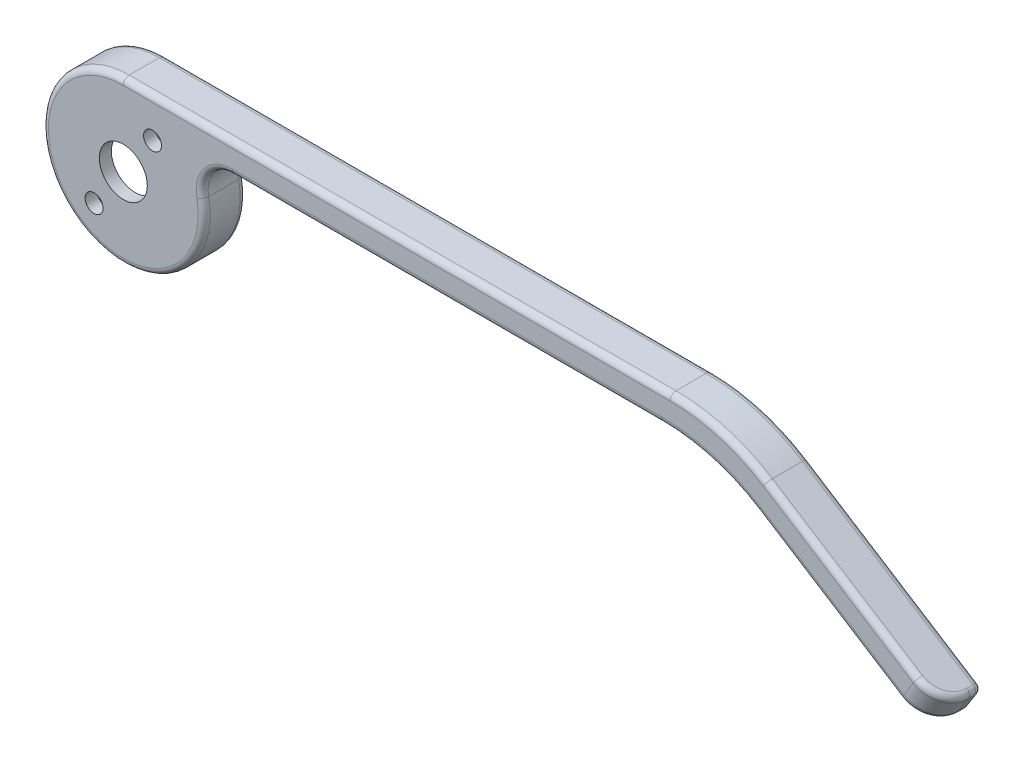
from build123d import *

# Parameters (mm, degrees)
ESQUISSE1_R             = 4
BOSS_EXTRU_1_DEPTH      = 3.5
CONG_1_R                = 5
ENL_V_START             = -2
ESQUISSE5_R             = 12.25
ENL_V_MAT_EXTRU_3_DEPTH = 136.544040158
ESQUISSE6_R             = 1.5
ENL_V_MAT_EXTRU_4_DEPTH = 138.544040158
CONG_3_R                = 30
CONG_2_R                = 1


with BuildPart() as part:
    # Esquisse1 → Boss.-Extru.1 (new, symmetric)
    with BuildSketch(Plane.XY):
        with BuildLine():
            Line((0, 13.5), (100, 13.5))
            Line((100, 13.5), (136.650514024, -9.779418024))
            Line((136.650514024, -9.779418024), (133.969714184, -14))
            Line((133.969714184, -14), (98.546295751, 8.5))
            Line((98.546295751, 8.5), (10.488088482, 8.5))
            ThreePointArc((10.488088482, 8.5), (-5.809475019, -12.186057607), (0, 13.5))
        make_face()
        Circle(ESQUISSE1_R, mode=Mode.SUBTRACT)
    extrude(amount=BOSS_EXTRU_1_DEPTH, both=True)

    # Congé1
    cong_1_edges = [part.edges().sort_by_distance(p)[0] for p in [
        (10.488088482, 8.5, 0),
        (135.310114104, -11.889709012, 3.5),
    ]]
    fillet(cong_1_edges, radius=CONG_1_R)

    # Esquisse5 → Enlèv. mat.-Extru.3 (cut, through all)
    with BuildSketch(Plane.XY.offset(3.5).offset(ENL_V_START)):
        Circle(ESQUISSE5_R)
    extrude(amount=-ENL_V_MAT_EXTRU_3_DEPTH, mode=Mode.SUBTRACT)

    # Esquisse6 → Enlèv. mat.-Extru.4 (cut, through all)
    with BuildSketch(Plane.XY.offset(3.5)):
        with Locations((4.875399709, 6.962792376)):
            Circle(ESQUISSE6_R)
        with Locations((-4.875399709, -6.962792376)):
            Circle(ESQUISSE6_R)
    extrude(amount=-ENL_V_MAT_EXTRU_4_DEPTH, mode=Mode.SUBTRACT)

    # Congé3
    cong_3_edges = [part.edges().sort_by_distance(p)[0] for p in [
        (98.546295751, 8.5, 0),
        (100, 13.5, 0),
    ]]
    fillet(cong_3_edges, radius=CONG_3_R)

    # Congé2
    cong_2_edges = [part.edges().sort_by_distance(p)[0] for p in [
        (45.638887252, 13.5, 3.5),
        (53.99498619, 8.5, 3.5),
        (14.31040412, 6.6835727, 3.5),
        (45.638887252, 13.5, -3.5),
        (53.99498619, 8.5, -3.5),
        (14.31040412, 6.6835727, -3.5),
        (-8.59564629, -10.409844613, 3.5),
        (-8.59564629, -10.409844613, -3.5),
        (119.896252796, 0.862436837, 3.5),
        (99.653192234, 12.307158448, 3.5),
        (117.829000751, -3.747854151, 3.5),
        (98.199487984, 7.307158448, 3.5),
        (122.006543784, -0.477963083, -3.5),
        (99.653192234, 12.307158448, -3.5),
        (119.93929174, -5.088254071, -3.5),
        (98.199487984, 7.307158448, -3.5),
        (133.969714184, -14, -2.5),
        (136.650514024, -9.779418024, -2.5),
        (135.310114104, -11.889709012, -3.5),
        (135.414334184, -8.99422993, 2.035533906),
        (132.733534344, -13.214811906, 2.035533906),
    ]]
    fillet(cong_2_edges, radius=CONG_2_R)


solid = part.part
